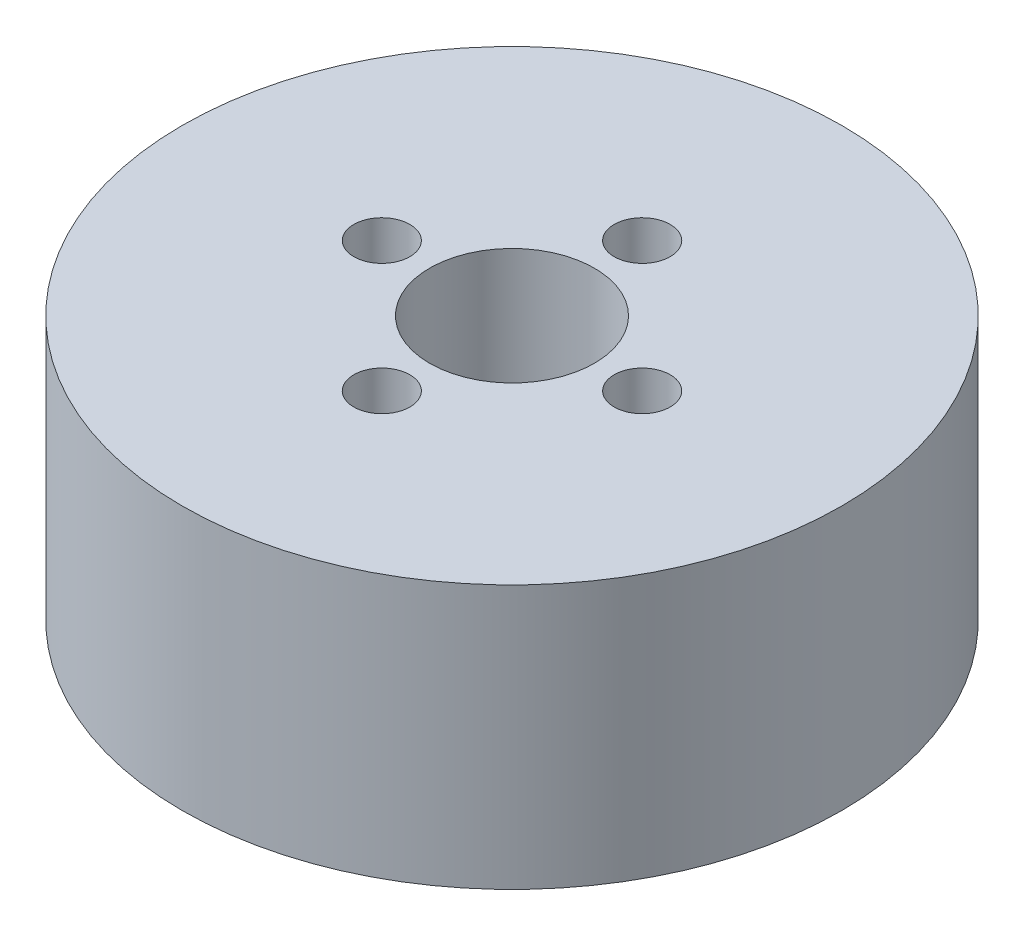
from build123d import *

# Parameters (mm, degrees)
SKETCH1_R           = 20
BOSS_EXTRUDE1_DEPTH = 16
SKETCH2_R           = 5
CUT_EXTRUDE1_DEPTH  = 33.496153619
SKETCH3_R           = 1.698180001
CUT_EXTRUDE2_DEPTH  = 12.425194902
CIRPATTERN1_COUNT   = 4


with BuildPart() as part:
    # Sketch1 → Boss-Extrude1 (new body)
    with BuildSketch(Plane(origin=(0, 0, 0), x_dir=(1, 0, 0), z_dir=(0, 1, 0))):
        Circle(SKETCH1_R)
    extrude(amount=BOSS_EXTRUDE1_DEPTH)

    # Sketch2 → Cut-Extrude1 (cut, through all)
    with BuildSketch(Plane(origin=(0, 0, 0), x_dir=(1, 0, 0), z_dir=(0, 1, 0))):
        Circle(SKETCH2_R)
    extrude(amount=CUT_EXTRUDE1_DEPTH, mode=Mode.SUBTRACT)

    # Sketch3 → Cut-Extrude2 (cut)
    with BuildSketch(Plane(origin=(0, 16, 0), x_dir=(1, 0, 0), z_dir=(0, 1, 0))):
        with Locations((-7.896526705, 0)):
            Circle(SKETCH3_R)
    cut_extrude2 = extrude(amount=-CUT_EXTRUDE2_DEPTH, mode=Mode.SUBTRACT)

    # CirPattern1: Cut-Extrude2 ×4 about axis
    cirpattern1_axis = Axis((0, 0, 0), (0, 1, 0))
    for i in range(1, CIRPATTERN1_COUNT):
        add(cut_extrude2.rotate(cirpattern1_axis, i * 360 / CIRPATTERN1_COUNT), mode=Mode.SUBTRACT)


solid = part.part
